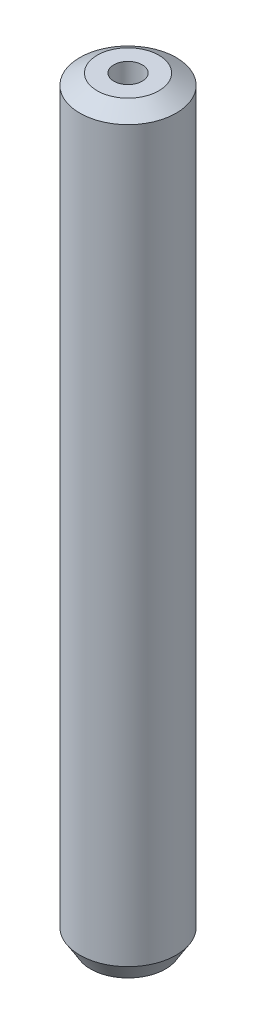
from build123d import *
from OCP.BRepFilletAPI import BRepFilletAPI_MakeChamfer

# Parameters (mm, degrees)
SKETCH1_R           = 12.5
BOSS_EXTRUDE1_DEPTH = 196.355624658
SKETCH2_R           = 3.690682042
CUT_EXTRUDE1_DEPTH  = 198.149768793
CHAMFER1_SIZE       = 2.768888985
CHAMFER1_SIZE2      = 4.502672056


with BuildPart() as part:
    # Sketch1 → Boss-Extrude1 (new body)
    with BuildSketch(Plane(origin=(0, 0, 0), x_dir=(1, 0, 0), z_dir=(0, 1, 0))):
        Circle(SKETCH1_R)
    extrude(amount=BOSS_EXTRUDE1_DEPTH)

    # Sketch2 → Cut-Extrude1 (cut, through all)
    with BuildSketch(Plane(origin=(0, 0, 0), x_dir=(1, 0, 0), z_dir=(0, 1, 0))):
        Circle(SKETCH2_R)
    extrude(amount=CUT_EXTRUDE1_DEPTH, mode=Mode.SUBTRACT)

    # Chamfer1: one chamfer whose edges measure the first distance from different faces: ONE call of the kernel's chamfer builder (chamfer() names one face for all edges)
    chamfer1_edges_1 = [part.edges().sort_by_distance(p)[0] for p in [
        (-12.5, 196.355624658, 0),
    ]]
    chamfer1_side_1 = [part.faces().sort_by_distance(p)[0] for p in [
        (-12.5, 98.177812329, 0),
    ]]
    chamfer1_edges_2 = [part.edges().sort_by_distance(p)[0] for p in [
        (-12.5, 0, 0),
    ]]
    chamfer1_side_2 = [part.faces().sort_by_distance(p)[0] for p in [
        (-12.146446609, 0, 0),
    ]]
    chamfer1 = BRepFilletAPI_MakeChamfer(part.part.solid().wrapped)
    for e in chamfer1_edges_1:
        chamfer1.Add(CHAMFER1_SIZE, CHAMFER1_SIZE2, e.wrapped, chamfer1_side_1[0].wrapped)  # the first distance lies on this face
    for e in chamfer1_edges_2:
        chamfer1.Add(CHAMFER1_SIZE, CHAMFER1_SIZE2, e.wrapped, chamfer1_side_2[0].wrapped)  # the first distance lies on this face
    add(Compound.cast(chamfer1.Shape()), mode=Mode.REPLACE)


solid = part.part
